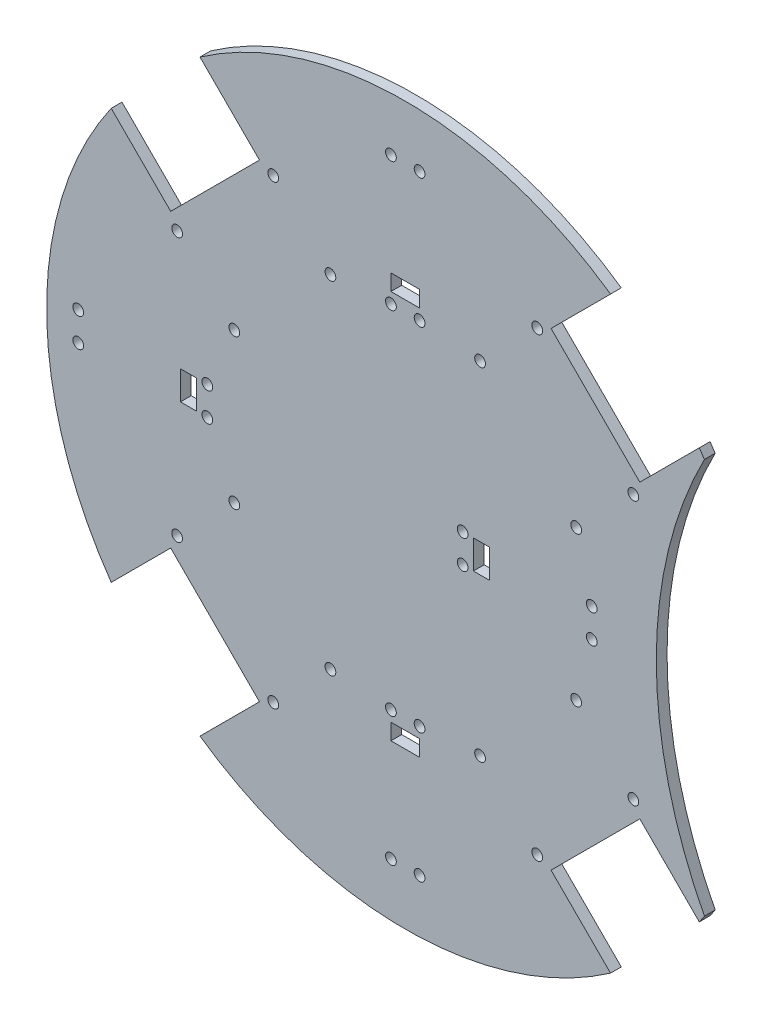
from build123d import *

# Parameters (mm, degrees)
CROQUIS1_R              = 100
SALIENTE_EXTRUIR1_DEPTH = 3
CROQUIS3_R              = 120
CORTAR_EXTRUIR1_DEPTH   = 3
CORTAR_EXTRUIR6_DEPTH   = 10
CROQUIS12_R             = 1.5
CORTAR_EXTRUIR7_DEPTH   = 142.453172464
CROQUIS9_R              = 1.5
CROQUIS9_W              = 4.5
CROQUIS9_H              = 8
CROQUIS9_W_2            = 8
CROQUIS9_H_2            = 4.5
CORTAR_EXTRUIR5_DEPTH   = 10


with BuildPart() as part:
    # Croquis1 → Saliente-Extruir1 (new body)
    with BuildSketch(Plane.XY):
        Circle(CROQUIS1_R)
    extrude(amount=SALIENTE_EXTRUIR1_DEPTH)

    # Croquis3 → Cortar-Extruir1 (cut)
    with BuildSketch(Plane.XY.offset(3)):
        with Locations((190, 0)):
            Circle(CROQUIS3_R)
    extrude(amount=-CORTAR_EXTRUIR1_DEPTH, mode=Mode.SUBTRACT)

    # Croquis5 → Cortar-Extruir6 (cut)
    with BuildSketch(Plane.XY.offset(3)):
        Polygon((-58.336309448, -83.085046789), (-83.085046789, -58.336309448), (-65.40737726, -40.658639918), (-40.658639918, -65.40737726), align=None)
        Polygon((-83.085046789, 58.336309448), (-58.336309448, 83.085046789), (-40.658639918, 65.40737726), (-65.40737726, 40.658639918), align=None)
        Polygon((58.336309448, -83.085046789), (83.085046789, -58.336309448), (65.40737726, -40.658639918), (40.658639918, -65.40737726), align=None)
        Polygon((58.336309448, 83.085046789), (83.085046789, 58.336309448), (65.40737726, 40.658639918), (40.658639918, 65.40737726), align=None)
    extrude(amount=-CORTAR_EXTRUIR6_DEPTH, mode=Mode.SUBTRACT)

    # Croquis12 → Cortar-Extruir7 (cut, through all)
    with BuildSketch(Plane.XY.offset(3)):
        with Locations((-63.604254904, -36.804908024)):
            Circle(CROQUIS12_R)
        with Locations((-36.804907897, -63.604255031)):
            Circle(CROQUIS12_R)
        with Locations((-47.666068056, -20.866721176)):
            Circle(CROQUIS12_R)
        with Locations((-20.866721049, -47.666068183)):
            Circle(CROQUIS12_R)
        with Locations((47.666068183, 20.866721049)):
            Circle(CROQUIS12_R)
        with Locations((20.866721176, 47.666068056)):
            Circle(CROQUIS12_R)
        with Locations((63.604255031, 36.804907897)):
            Circle(CROQUIS12_R)
        with Locations((36.804908024, 63.604254904)):
            Circle(CROQUIS12_R)
        with Locations((20.866721325, -47.666067908)):
            Circle(CROQUIS12_R)
        with Locations((47.666068332, -20.866720901)):
            Circle(CROQUIS12_R)
        with Locations((63.60425518, -36.804907749)):
            Circle(CROQUIS12_R)
        with Locations((36.804908173, -63.604254756)):
            Circle(CROQUIS12_R)
        with Locations((-63.604254756, 36.804908173)):
            Circle(CROQUIS12_R)
        with Locations((-36.804907749, 63.60425518)):
            Circle(CROQUIS12_R)
        with Locations((-20.866720901, 47.666068332)):
            Circle(CROQUIS12_R)
        with Locations((-47.666067908, 20.866721325)):
            Circle(CROQUIS12_R)
    extrude(amount=-CORTAR_EXTRUIR7_DEPTH, mode=Mode.SUBTRACT)

    # Croquis9 → Cortar-Extruir5 (cut)
    with BuildSketch(Plane.XY.offset(3)):
        with Locations((52, -4)):
            Circle(CROQUIS9_R)
        with Locations((16, 4)):
            Circle(CROQUIS9_R)
        with Locations((52, 4)):
            Circle(CROQUIS9_R)
        with Locations((16, -4)):
            Circle(CROQUIS9_R)
        with Locations((-91.190074744, 4)):
            Circle(CROQUIS9_R)
        with Locations((-91.190074744, -4)):
            Circle(CROQUIS9_R)
        with Locations((-55.190074744, 4)):
            Circle(CROQUIS9_R)
        with Locations((-55.190074744, -4)):
            Circle(CROQUIS9_R)
        with Locations((-4, 85)):
            Circle(CROQUIS9_R)
        with Locations((4, 85)):
            Circle(CROQUIS9_R)
        with Locations((-4, 49)):
            Circle(CROQUIS9_R)
        with Locations((4, 49)):
            Circle(CROQUIS9_R)
        with Locations((-4, -49)):
            Circle(CROQUIS9_R)
        with Locations((4, -49)):
            Circle(CROQUIS9_R)
        with Locations((4, -85)):
            Circle(CROQUIS9_R)
        with Locations((-4, -85)):
            Circle(CROQUIS9_R)
        with Locations((21.25, 0)):
            Rectangle(CROQUIS9_W, CROQUIS9_H)
        with Locations((0, -54.25)):
            Rectangle(CROQUIS9_W_2, CROQUIS9_H_2)
        with Locations((-60.440074744, 0)):
            Rectangle(CROQUIS9_W, CROQUIS9_H)
        with Locations((0, 54.25)):
            Rectangle(CROQUIS9_W_2, CROQUIS9_H_2)
    extrude(amount=-CORTAR_EXTRUIR5_DEPTH, mode=Mode.SUBTRACT)


solid = part.part
